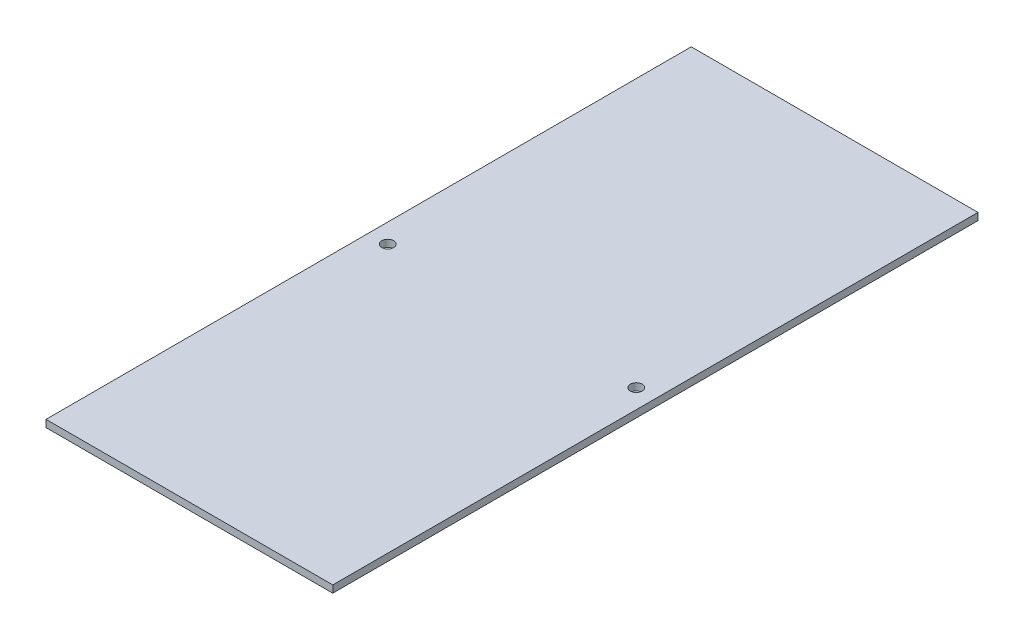
from build123d import *

# Parameters (mm, degrees)
SKETCH1_W          = 120
SKETCH1_H          = 270
BASE_FLANGE1_DEPTH = 3
SKETCH6_R          = 2.5
CUT_EXTRUDE1_DEPTH = 10


# Sheet-metal steps are written as plain solids
with BuildPart() as part:
    # Sketch1 → Base-Flange1 (new body)
    with BuildSketch(Plane(origin=(0, 0, 0), x_dir=(1, 0, 0), z_dir=(0, 1, 0))):
        Rectangle(SKETCH1_W, SKETCH1_H)
    extrude(amount=-BASE_FLANGE1_DEPTH)

    # Sketch6 → Cut-Extrude1 (cut)
    with BuildSketch(Plane(origin=(0, 0, 0), x_dir=(1, 0, 0), z_dir=(0, 1, 0))):
        with Locations(Location((-52, 0, 0), (0, 0, 270))):
            Circle(SKETCH6_R)
        with Locations(Location((52, 0, 0), (0, 0, 270))):
            Circle(SKETCH6_R)
    extrude(amount=-CUT_EXTRUDE1_DEPTH, mode=Mode.SUBTRACT)


solid = part.part
